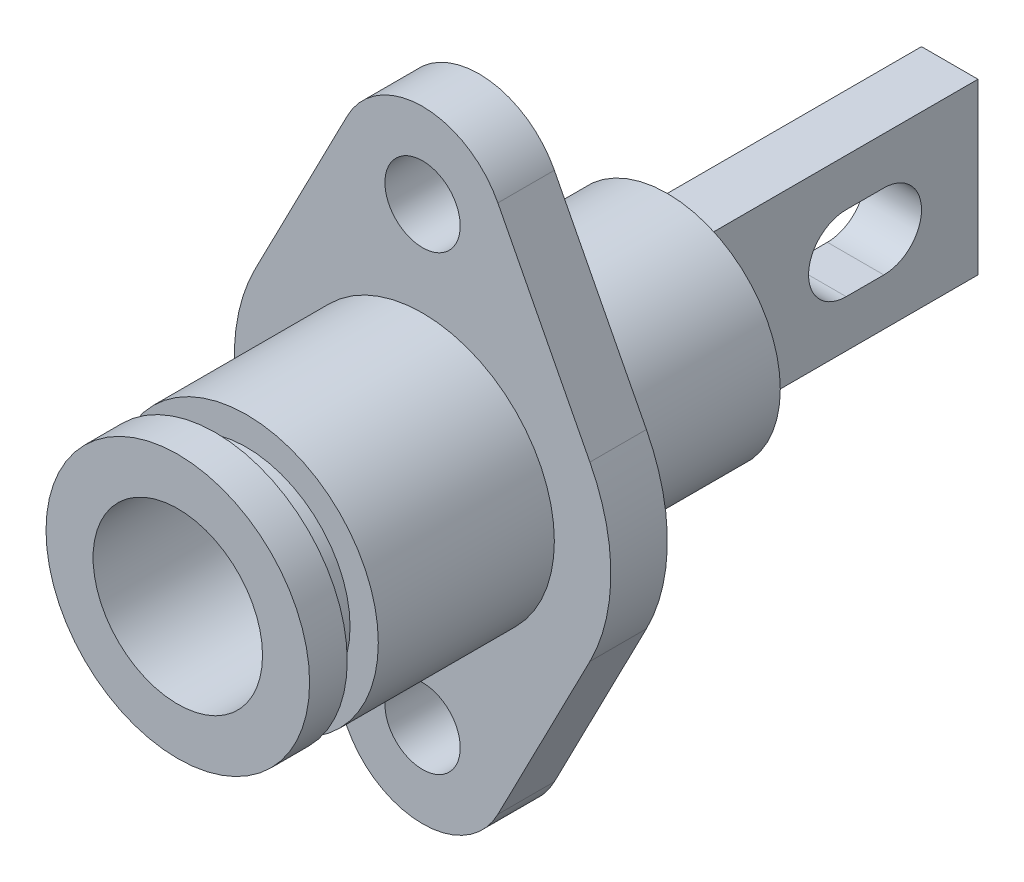
from build123d import *

# Parameters (mm, degrees)
SKETCH1_R           = 2
BOSS_EXTRUDE1_DEPTH = 3
SKETCH2_R           = 7
BOSS_EXTRUDE2_DEPTH = 9.35
SKETCH3_R           = 7.5
BOSS_EXTRUDE3_DEPTH = 0.5
SKETCH4_W           = 3
SKETCH4_H           = 9
BOSS_EXTRUDE4_DEPTH = 24.5
SKETCH5_R           = 6
BOSS_EXTRUDE5_DEPTH = 9.5
SKETCH8_R           = 5.5
BOSS_EXTRUDE6_DEPTH = 1.65
SKETCH9_R           = 7
BOSS_EXTRUDE7_DEPTH = 2
SKETCH10_R          = 4.5
CUT_EXTRUDE1_DEPTH  = 25
CUT_EXTRUDE2_DEPTH  = 3


with BuildPart() as part:
    # Sketch1 → Boss-Extrude1 (new body)
    with BuildSketch(Plane.XY):
        with BuildLine():
            Line((-3.99951164, 14.062500095), (-8.887803753, 4.583333333))
            ThreePointArc((-8.887803753, 4.583333333), (-10, 0), (-8.887803753, -4.583333333))
            Line((-8.887803753, -4.583333333), (-3.999511648, -14.062500079))
            ThreePointArc((-3.999511648, -14.062500079), (-8.7e-08, -16.5), (3.999511568, -14.062500234))
            Line((3.999511568, -14.062500234), (8.887803753, -4.583333333))
            ThreePointArc((8.887803753, -4.583333333), (10, 0), (8.887803753, 4.583333333))
            Line((8.887803753, 4.583333333), (3.999511579, 14.062500214))
            ThreePointArc((3.999511579, 14.062500214), (-6.7e-08, 16.5), (-3.99951164, 14.062500095))
        make_face()
        with Locations((0, 12)):
            Circle(SKETCH1_R, mode=Mode.SUBTRACT)
        with Locations((0, -12)):
            Circle(SKETCH1_R, mode=Mode.SUBTRACT)
    extrude(amount=BOSS_EXTRUDE1_DEPTH)

    # Sketch2 → Boss-Extrude2 (add)
    with BuildSketch(Plane.XY.offset(3)):
        Circle(SKETCH2_R)
    extrude(amount=BOSS_EXTRUDE2_DEPTH)

    # Sketch3 → Boss-Extrude3 (add)
    with BuildSketch(Plane(origin=(0, 0, 0), x_dir=(-1, 0, 0), z_dir=(0, 0, -1))):
        Circle(SKETCH3_R)
    extrude(amount=BOSS_EXTRUDE3_DEPTH)

    # Sketch4 → Boss-Extrude4 (add)
    with BuildSketch(Plane(origin=(0, 0, -0.5), x_dir=(-1, 0, 0), z_dir=(0, 0, -1))):
        Rectangle(SKETCH4_W, SKETCH4_H)
    extrude(amount=BOSS_EXTRUDE4_DEPTH)

    # Sketch5 → Boss-Extrude5 (add)
    with BuildSketch(Plane(origin=(0, 0, -0.5), x_dir=(-1, 0, 0), z_dir=(0, 0, -1))):
        Circle(SKETCH5_R)
    extrude(amount=BOSS_EXTRUDE5_DEPTH)

    # Sketch8 → Boss-Extrude6 (add)
    with BuildSketch(Plane.XY.offset(12.35)):
        Circle(SKETCH8_R)
    extrude(amount=BOSS_EXTRUDE6_DEPTH)

    # Sketch9 → Boss-Extrude7 (add)
    with BuildSketch(Plane.XY.offset(14)):
        Circle(SKETCH9_R)
    extrude(amount=BOSS_EXTRUDE7_DEPTH)

    # Sketch10 → Cut-Extrude1 (cut)
    with BuildSketch(Plane.XY.offset(16)):
        Circle(SKETCH10_R)
    extrude(amount=-CUT_EXTRUDE1_DEPTH, mode=Mode.SUBTRACT)

    # Sketch15 → Cut-Extrude2 (cut)
    with BuildSketch(Plane(origin=(1.5, 0, 0), x_dir=(0, 0, -1), z_dir=(1, 0, 0))):
        with BuildLine():
            Line((20, -2), (18, -2))
            ThreePointArc((18, -2), (16, 0), (18, 2))
            Line((18, 2), (20, 2))
            ThreePointArc((20, 2), (22, 0), (20, -2))
        make_face()
    extrude(amount=-CUT_EXTRUDE2_DEPTH, mode=Mode.SUBTRACT)


solid = part.part
